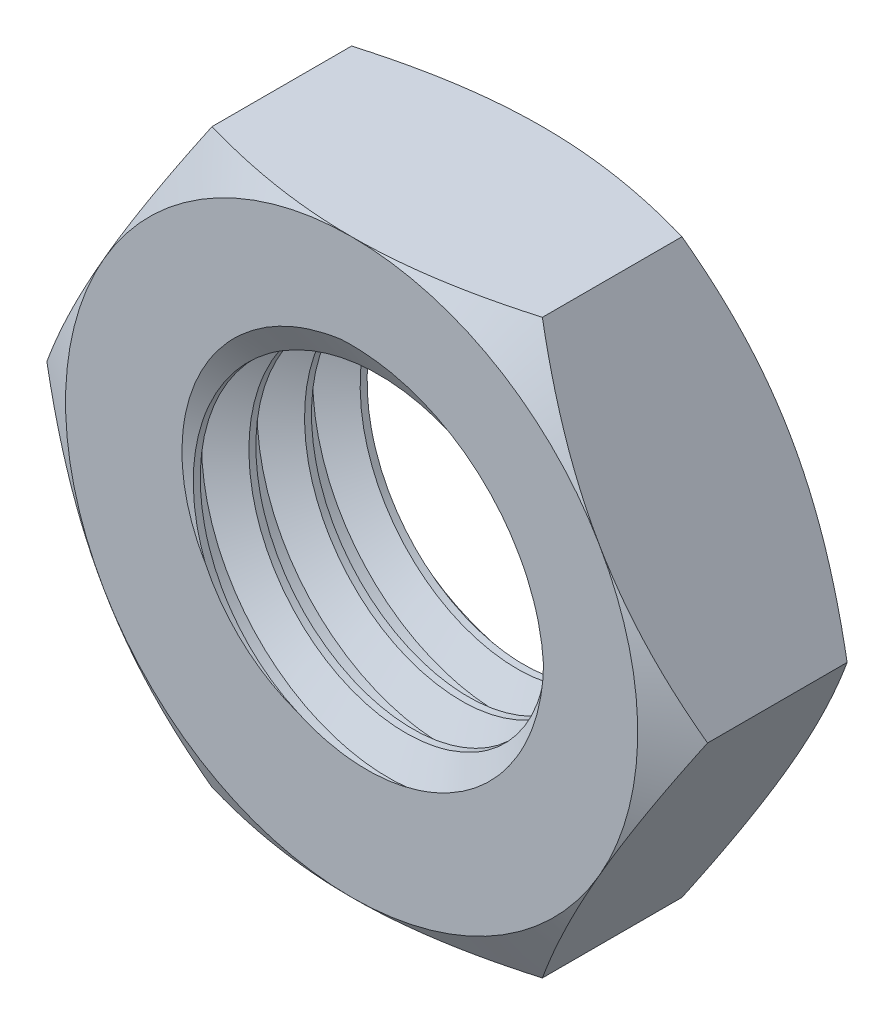
from build123d import *

# Parameters (mm, degrees)
BOSS_EXTRUDE1_DEPTH     = 6
M12X1_75_TAPPED_HOLE1_D = 10.2
THREAD1_PITCH           = 1.75


with BuildPart() as part:
    # Sketch1 → Boss-Extrude1 (new body)
    with BuildSketch(Plane.XY):
        Polygon((5.196152423, 9), (-5.196152423, 9), (-10.392304845, 0), (-5.196152423, -9), (5.196152423, -9), (10.392304845, 0), align=None)
    extrude(amount=BOSS_EXTRUDE1_DEPTH)

    # Sketch3 → Cut-Revolve1 (revolve, cut)
    with BuildSketch(Plane(origin=(0, 0, 0), x_dir=(0, 0, -1), z_dir=(1, 0, 0))):
        Polygon((0, 9), (0, 11.822639189), (-1.629651496, 11.822639189), align=None)
    cut_revolve1 = revolve(axis=Axis((0, 0, 0), (0, 0, -1)), mode=Mode.SUBTRACT)

    # Mirror1: Cut-Revolve1 across plane
    add(cut_revolve1.mirror(Plane(origin=(0, 0, 3), x_dir=(1, 0, 0), z_dir=(0, 0, -1))), mode=Mode.SUBTRACT)

    # M12x1.75 Tapped Hole1 (through all)
    with Locations(Plane(origin=(0, 0, 0), x_dir=(-1, 0, 0), z_dir=(0, 0, -1))):
        with Locations((0, 0)):
            Hole(M12X1_75_TAPPED_HOLE1_D / 2)

    # Thread1: the profile of Thread Profile1 profile screwed along a right-hand helix of 11.428571 turns, 10 arcs to a turn; built about Z, then put on its axis
    thread1_z = Axis((0, 0, 0), (0, 0, 1))
    thread1_corners = [(5.0997, 0, -0.000173205), (5.0997, 0, 1.5314232), (6.047215281, 0, 0.984374998), (6.047215281, 0, 0.546874998)]
    with BuildLine(mode=Mode.PRIVATE) as thread1_profile:
        Line(thread1_corners[0], thread1_corners[1])
        Line(thread1_corners[1], thread1_corners[2])
        Line(thread1_corners[2], thread1_corners[3])
        Line(thread1_corners[3], thread1_corners[0])
    thread1_cap = Face(thread1_profile.wire())
    thread1_turn_angles = [0, 18, 36, 54, 72, 90, 108, 126, 144, 162, 180, 198, 216, 234, 252, 270, 288, 306, 324, 342, 360]
    thread1_turn_weights = [1, 0.9510565162951535, 1, 0.9510565162951535, 1, 0.9510565162951535, 1, 0.9510565162951535, 1, 0.9510565162951535, 1, 0.9510565162951535, 1, 0.9510565162951535, 1, 0.9510565162951535, 1, 0.9510565162951535, 1, 0.9510565162951535, 1]
    thread1_turn_rails = [Edge.make_bspline([Vector(p[0], p[1], 0).rotate(thread1_z, thread1_turn_angles[k]) / thread1_turn_weights[k] + Vector(0, 0, p[2] + THREAD1_PITCH * thread1_turn_angles[k] / 360) for k in range(21)], [0, 0, 0, 1, 1, 2, 2, 3, 3, 4, 4, 5, 5, 6, 6, 7, 7, 8, 8, 9, 9, 10, 10, 10], 2, thread1_turn_weights) for p in thread1_corners]
    thread1_turn_sides = [Face.make_surface_from_curves(thread1_turn_rails[p[0]], thread1_turn_rails[p[1]]) for p in [(0, 1), (1, 2), (2, 3), (3, 0)]]
    thread1_last_angles = [3960, 3978, 3996, 4014, 4032, 4050, 4068, 4086, 4104, 4109.142857143, 4114.285714286]
    thread1_last_weights = [1, 0.9510565162951535, 1, 0.9510565162951535, 1, 0.9510565162951535, 1, 0.9510565162951535, 1, 0.9959742939952387, 1]
    thread1_last_rails = [Edge.make_bspline([Vector(p[0], p[1], 0).rotate(thread1_z, thread1_last_angles[k]) / thread1_last_weights[k] + Vector(0, 0, p[2] + THREAD1_PITCH * thread1_last_angles[k] / 360) for k in range(11)], [0, 0, 0, 1, 1, 2, 2, 3, 3, 4, 4, 5, 5, 5], 2, thread1_last_weights) for p in thread1_corners]
    thread1_last_sides = [Face.make_surface_from_curves(thread1_last_rails[p[0]], thread1_last_rails[p[1]]) for p in [(0, 1), (1, 2), (2, 3), (3, 0)]]
    thread1 = Plane(origin=(0, 0, -2), x_dir=(1, 0, 0), z_dir=(0, 0, 1)) * Solid(Shell([*[p.moved(Location((0, 0, THREAD1_PITCH * i))) for i in range(11) for p in thread1_turn_sides], *thread1_last_sides, thread1_cap, thread1_cap.rotate(thread1_z, 4114.285714286).moved(Location((0, 0, THREAD1_PITCH * 4114.285714286 / 360)))]))
    add(thread1, mode=Mode.SUBTRACT)


solid = part.part
